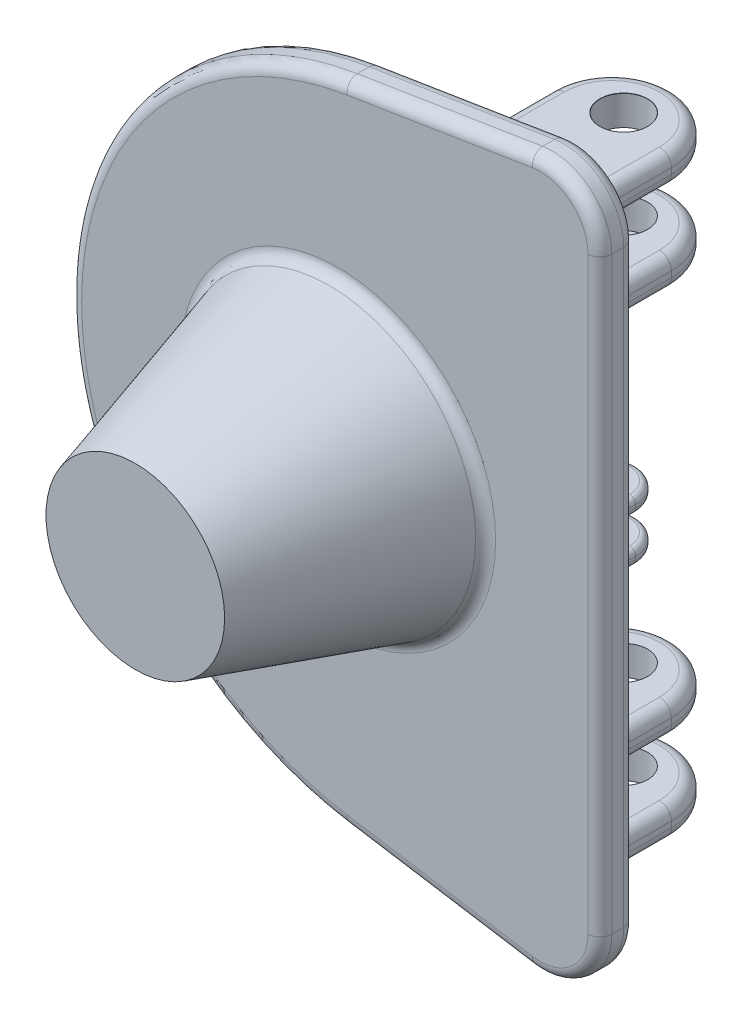
from build123d import *

# Parameters (mm, degrees)
BOSS_EXTRUDE1_DEPTH             = 6
BOSS_EXTRUDE3_DEPTH             = 20
F_8_0MM_DOWEL_HOLE2_D           = 8
F_8_0MM_DOWEL_HOLE2_DEPTH       = 24.5
F_8_0MM_DOWEL_HOLE2_CSINK_D     = 8.05
F_8_0MM_DOWEL_HOLE2_CSINK_ANGLE = 90
F_8_0MM_DOWEL_HOLE2_TIP         = 2.403442476
CUT_EXTRUDE3_DEPTH              = 30
BOSS_EXTRUDE5_DEPTH             = 20
CUT_EXTRUDE4_DEPTH              = 126.005677492
BOSS_EXTRUDE6_DEPTH             = 5
CUT_EXTRUDE6_DEPTH              = 108.945936931
SKETCH27_R                      = 25
SKETCH26_R                      = 15
FILLET4_R                       = 2
FILLET5_R                       = 2
FILLET6_R                       = 1
FILLET7_R                       = 2


with BuildPart() as part:
    # Sketch1 → Boss-Extrude1 (new body)
    with BuildSketch(Plane.XY):
        with BuildLine():
            Line((34, 49.436828377), (34, -49.436828377))
            ThreePointArc((34, -49.436828377), (30.485571661, -57.048487869), (22.412527955, -59.310020997))
            Line((22.412527955, -59.310020997), (-8.731096247, -54.302559409))
            ThreePointArc((-8.731096247, -54.302559409), (-55, 0), (-8.731096247, 54.302559409))
            Line((-8.731096247, 54.302559409), (22.412527955, 59.310020997))
            ThreePointArc((22.412527955, 59.310020997), (30.485571661, 57.048487869), (34, 49.436828377))
        make_face()
    extrude(amount=BOSS_EXTRUDE1_DEPTH)

    # Sketch9 → Boss-Extrude3 (add)
    with BuildSketch(Plane(origin=(-45, 0, 0), x_dir=(0, 0, -1), z_dir=(1, 0, 0))):
        with BuildLine():
            Line((0, -10), (0, 10))
            Line((0, 10), (25, 10))
            Line((25, 10), (25, 5))
            Line((25, 5), (6, 5))
            ThreePointArc((6, 5), (4.585786438, 4.414213562), (4, 3))
            Line((4, 3), (4, -3))
            ThreePointArc((4, -3), (4.585786438, -4.414213562), (6, -5))
            Line((6, -5), (25, -5))
            Line((25, -5), (25, -10))
            Line((25, -10), (0, -10))
        make_face()
    extrude(amount=BOSS_EXTRUDE3_DEPTH)

    # Ø8.0mm Dowel Hole2
    with Locations(Plane(origin=(-35, 10, -17), x_dir=(0, 0, 1), z_dir=(0, 1, 0))):
        with Locations((0, 0)):
            CounterSinkHole(F_8_0MM_DOWEL_HOLE2_D / 2, F_8_0MM_DOWEL_HOLE2_CSINK_D / 2, depth=F_8_0MM_DOWEL_HOLE2_DEPTH, counter_sink_angle=F_8_0MM_DOWEL_HOLE2_CSINK_ANGLE)
            with Locations((0, 0, -(F_8_0MM_DOWEL_HOLE2_DEPTH + F_8_0MM_DOWEL_HOLE2_TIP / 2))):  # 118° drill point
                Cone(0, F_8_0MM_DOWEL_HOLE2_D / 2, F_8_0MM_DOWEL_HOLE2_TIP, mode=Mode.SUBTRACT)

    # Sketch11 → Cut-Extrude3 (cut)
    with BuildSketch(Plane(origin=(0, 10, 0), x_dir=(1, 0, 0), z_dir=(0, 1, 0))):
        with BuildLine():
            Line((-45, 25), (-45, 14.99999999))
            ThreePointArc((-45, 14.99999999), (-42.071067815, 22.071067808), (-35, 25))
            Line((-35, 25), (-45, 25))
        make_face()
        with BuildLine():
            Line((-25, 25), (-35, 25))
            ThreePointArc((-35, 25), (-27.928932459, 22.071068083), (-25, 15.000000767))
            Line((-25, 15.000000767), (-25, 25))
        make_face()
    extrude(amount=-CUT_EXTRUDE3_DEPTH, mode=Mode.SUBTRACT)

    # Sketch14 → Boss-Extrude5 (add)
    with BuildSketch(Plane(origin=(5, 0, 0), x_dir=(0, 0, -1), z_dir=(1, 0, 0))):
        with BuildLine():
            Line((0, 40), (0, 30))
            Line((0, 30), (25, 30))
            Line((25, 30), (25, 35))
            Line((25, 35), (6, 35))
            ThreePointArc((6, 35), (4.585786438, 35.585786438), (4, 37))
            Line((4, 37), (4, 43))
            ThreePointArc((4, 43), (4.585786438, 44.414213562), (6, 45))
            Line((6, 45), (25, 45))
            Line((25, 45), (25, 50))
            Line((25, 50), (0, 50))
            Line((0, 50), (0, 40))
        make_face()
    boss_extrude5 = extrude(amount=BOSS_EXTRUDE5_DEPTH)

    # Sketch17 → Ø8.0mm Dowel Hole3 (revolve, cut)
    with BuildSketch(Plane(origin=(15, 50, -17), x_dir=(0, 0, 1), z_dir=(1, 0, 0))):
        Polygon((0, 0), (0, 26.903442476), (4, 24.5), (4, 0.025), (4.025, 0), align=None)
    f_8_0mm_dowel_hole3 = revolve(axis=Axis((15, 56.35, -17), (0, -1, 0)), mode=Mode.SUBTRACT)

    # Mirror1: Boss-Extrude5, Ø8.0mm Dowel Hole3 across plane
    add(boss_extrude5.mirror(Plane.ZX))
    add(f_8_0mm_dowel_hole3.mirror(Plane.ZX), mode=Mode.SUBTRACT)

    # Sketch19 → Cut-Extrude4 (cut, through all)
    with BuildSketch(Plane(origin=(0, 50, 0), x_dir=(1, 0, 0), z_dir=(0, 1, 0))):
        with BuildLine():
            Line((5, 25), (5, 15))
            ThreePointArc((5, 15), (7.928932188, 22.071067812), (15, 25))
            Line((15, 25), (5, 25))
        make_face()
        with BuildLine():
            Line((25, 25), (15, 25))
            ThreePointArc((15, 25), (22.071067812, 22.071067812), (25, 15))
            Line((25, 15), (25, 25))
        make_face()
    extrude(amount=-CUT_EXTRUDE4_DEPTH, mode=Mode.SUBTRACT)

    # Sketch22 → Boss-Extrude6 (add, symmetric)
    with BuildSketch(Plane(origin=(0, 0, 0), x_dir=(0, 0, -1), z_dir=(1, 0, 0))):
        with BuildLine():
            Line((0, 27), (34, 27))
            Line((34, 27), (34, 24.5))
            Line((34, 24.5), (6, 24.5))
            ThreePointArc((6, 24.5), (4.585786438, 23.914213562), (4, 22.5))
            Line((4, 22.5), (4, 21.5))
            ThreePointArc((4, 21.5), (4.585786438, 20.085786438), (6, 19.5))
            Line((6, 19.5), (34, 19.5))
            Line((34, 19.5), (34, 17))
            Line((34, 17), (0, 17))
            Line((0, 17), (0, 27))
        make_face()
    boss_extrude6 = extrude(amount=BOSS_EXTRUDE6_DEPTH, both=True)

    # Sketch23 → Ø5.0mm Dowel Hole1 (revolve, cut)
    with BuildSketch(Plane(origin=(0, 17, -29), x_dir=(0, 0, -1), z_dir=(1, 0, 0))):
        Polygon((0, 0), (0, 26.002151548), (2.5, 24.5), (2.5, 0.025), (2.525, 0), align=None)
    f_5_0mm_dowel_hole1 = revolve(axis=Axis((0, 10.65, -29), (0, 1, 0)), mode=Mode.SUBTRACT)

    # Mirror2: Boss-Extrude6, Ø5.0mm Dowel Hole1 across plane
    add(boss_extrude6.mirror(Plane.ZX))
    add(f_5_0mm_dowel_hole1.mirror(Plane.ZX), mode=Mode.SUBTRACT)

    # Sketch25 → Cut-Extrude6 (cut, through all)
    with BuildSketch(Plane(origin=(0, 27, 0), x_dir=(1, 0, 0), z_dir=(0, 1, 0))):
        with BuildLine():
            Line((-5, 34), (-5, 29))
            ThreePointArc((-5, 29), (-3.535533906, 32.535533906), (0, 34))
            Line((0, 34), (-5, 34))
        make_face()
        with BuildLine():
            Line((5, 34), (0, 34))
            ThreePointArc((0, 34), (3.535533906, 32.535533906), (5, 29))
            Line((5, 29), (5, 34))
        make_face()
    extrude(amount=-CUT_EXTRUDE6_DEPTH, mode=Mode.SUBTRACT)

    # Sketch27 → Loft1 section 0
    with BuildSketch(Plane.XY.offset(6)):
        with Locations((-10, 0)):
            Circle(SKETCH27_R)
    # Sketch26 → Loft1 section 1
    with BuildSketch(Plane.XY.offset(40)):
        with Locations((-10, 0)):
            Circle(SKETCH26_R)
    loft()

    # Fillet4
    fillet4_edges = [part.edges().sort_by_distance(p)[0] for p in [
        (30.485571661, 57.048487869, 6),
        (6.840715854, 56.806290203, 6),
        (-55, 0, 6),
        (6.840715854, -56.806290203, 6),
        (30.485571661, -57.048487869, 6),
        (6.840715854, -56.806290203, 0),
        (-55, 0, 0),
        (6.840715854, 56.806290203, 0),
        (30.485571661, 57.048487869, 0),
        (34, 0, 0),
        (30.485571661, -57.048487869, 0),
        (34, 0, 6),
    ]]
    fillet(fillet4_edges, radius=FILLET4_R)

    # Fillet5
    fillet5_edges = [part.edges().sort_by_distance(p)[0] for p in [
        (5, 35.585786438, -4.585786438),
        (5, 40, -4),
        (25, 44.414213562, -4.585786438),
        (25, 50, -7.5),
        (5, 40, 0),
        (25, 40, 0),
        (15, 50, 0),
        (5, 30, -7.5),
        (15, 30, 0),
        (25, 35.585786438, -4.585786438),
        (25, 40, -4),
        (25, 30, -7.5),
        (5, 50, -7.5),
        (5, 44.414213562, -4.585786438),
        (25, -30, -7.5),
        (5, -40, 0),
        (25, -40, 0),
        (15, -30, 0),
        (5, -50, -7.5),
        (15, -50, 0),
        (5, -44.414213562, -4.585786438),
        (25, -40, -4),
        (25, -35.585786438, -4.585786438),
        (25, -50, -7.5),
        (25, -44.414213562, -4.585786438),
        (5, -35.585786438, -4.585786438),
        (5, -40, -4),
        (5, -30, -7.5),
        (5, -35, -10.5),
        (5, -45, -10.5),
        (5, 45, -10.5),
        (5, 35, -10.5),
        (15, 35, -25),
        (15, 45, -25),
        (15, 50, -25),
        (15, 30, -25),
        (15, -50, -25),
        (15, -45, -25),
        (15, -30, -25),
        (15, -35, -25),
        (-45, -10, -7.499999995),
        (-35, -10, 0),
        (-45, -4.414213562, -4.585786438),
        (-45, 0, -4),
        (-45, 4.414213562, -4.585786438),
        (-45, 5, -10.499999995),
        (25, -45, -10.5),
        (25, -35, -10.5),
        (25, 35, -10.5),
        (25, 45, -10.5),
        (-45, 0, 0),
        (-35, 10, 0),
        (-25, -10, -7.500000383),
        (-25, -4.414213562, -4.585786438),
        (-25, 0, -4),
        (-25, 4.414213562, -4.585786438),
        (-25, 5, -10.500000383),
        (-25, 0, 0),
        (-45, 10, -7.499999995),
        (-45, -5, -10.499999995),
        (-35.000000388, -10, -25),
        (-35.000000388, -5, -25),
        (-35.000000388, 5, -25),
        (-35.000000388, 10, -25),
        (-25, -5, -10.500000383),
        (-25, 10, -7.500000383),
    ]]
    fillet(fillet5_edges, radius=FILLET5_R - 0.0001)  # a hair under: the kernel refuses the full size

    # Fillet6
    fillet6_edges = [part.edges().sort_by_distance(p)[0] for p in [
        (5, -19.5, -17.5),
        (0, -19.5, -34),
        (-5, -19.5, -17.5),
        (-5, -22, -4),
        (-5, -23.914213562, -4.585786438),
        (-5, -24.5, -17.5),
        (0, -24.5, -34),
        (5, -24.5, -17.5),
        (5, -23.914213562, -4.585786438),
        (5, -22, -4),
        (-5, 17, -14.5),
        (0, 17, -34),
        (5, 27, -14.5),
        (0, 27, -34),
        (-5, 23.914213562, -4.585786438),
        (-5, 22, -4),
        (-5, 20.085786438, -4.585786438),
        (-5, 19.5, -17.5),
        (0, 19.5, -34),
        (5, 19.5, -17.5),
        (5, 20.085786438, -4.585786438),
        (5, 22, -4),
        (5, 23.914213562, -4.585786438),
        (5, 24.5, -17.5),
        (0, 24.5, -34),
        (5, -17, -14.5),
        (0, -17, -34),
        (5, -27, -14.5),
        (0, -27, -34),
        (5, -22, 0),
        (0, -27, 0),
        (-5, -22, 0),
        (0, -17, 0),
        (-5, -20.085786438, -4.585786438),
        (5, -20.085786438, -4.585786438),
        (5, 17, -14.5),
        (-5, 27, -14.5),
        (-5, 24.5, -17.5),
        (-5, -17, -14.5),
        (-5, -27, -14.5),
    ]]
    fillet(fillet6_edges, radius=FILLET6_R)

    # Fillet7
    fillet7_edges = [part.edges().sort_by_distance(p)[0] for p in [
        (-35, 0, 6),
    ]]
    fillet(fillet7_edges, radius=FILLET7_R)


solid = part.part
